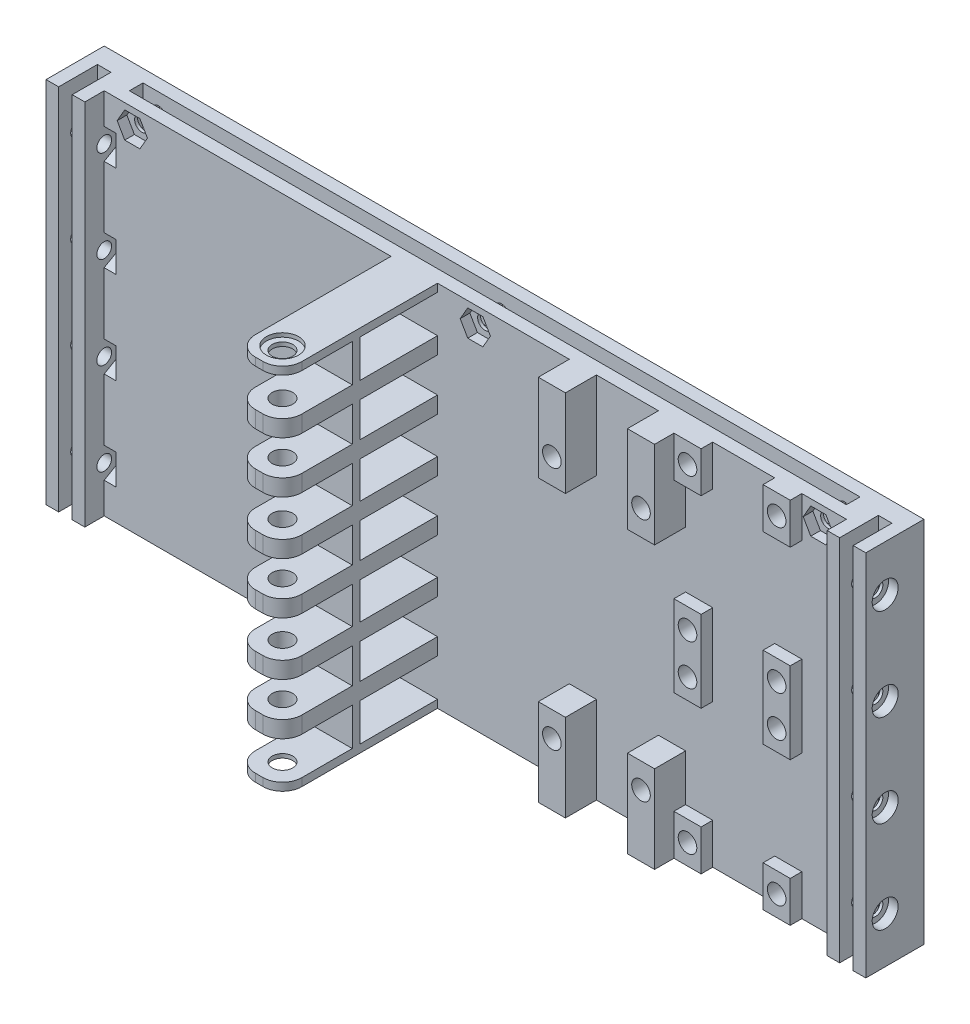
from build123d import *

# Parameters (mm, degrees)
SKETCH1_W               = 95
SKETCH1_H               = 12
BOSS_EXTRUDE1_DEPTH     = 10
SKETCH3_W               = 12
SKETCH3_H               = 2.025
SKETCH3_H_2             = 4.3
BOSS_EXTRUDE2_DEPTH     = 40
FILLET1_R               = 5
FILLET1_OF_MIRROR1_R    = 5
SKETCH5_R               = 2.65
CUT_EXTRUDE1_DEPTH      = 109.023145668
CUT_EXTRUDE2_DEPTH      = 1
SKETCH8_W               = 84
SKETCH8_H               = 95
SKETCH8_W_2             = 115.5
BOSS_EXTRUDE3_DEPTH     = 10
SKETCH9_W               = 10
SKETCH9_H               = 95
BOSS_EXTRUDE4_DEPTH     = 5
BOSS_EXTRUDE6_START     = 2.025
SKETCH13_W              = 12
SKETCH13_H              = 2
BOSS_EXTRUDE6_DEPTH     = 90.95
SKETCH14_W              = 185
SKETCH14_H              = 3.5
CUT_EXTRUDE4_DEPTH      = 10
SKETCH15_R              = 1.9
CUT_EXTRUDE5_DEPTH      = 199.641431949
SKETCH16_R              = 3.35
CUT_EXTRUDE6_DEPTH      = 2.5
CUT_EXTRUDE7_DEPTH      = 2.5
LPATTERN2_COUNT         = 3
LPATTERN2_PITCH         = 88.5
SKETCH18_W              = 7
SKETCH18_H              = 95
BOSS_EXTRUDE7_DEPTH     = 3
SKETCH19_W              = 7
SKETCH19_H              = 95
BOSS_EXTRUDE8_DEPTH     = 8
CUT_EXTRUDE8_REACH      = 159.687
SKETCH20_W              = 3.5
SKETCH20_H              = 10
LPATTERN3_COUNT         = 2
LPATTERN3_PITCH         = 201.5
SKETCH21_R              = 2.4
CUT_EXTRUDE9_DEPTH      = 3.8
SKETCH22_R              = 1.75
CUT_EXTRUDE10_DEPTH     = 0.6
SKETCH23_R              = 2.4
CUT_EXTRUDE11_DEPTH     = 3.8
SKETCH24_R              = 1.75
CUT_EXTRUDE12_DEPTH     = 0.6
LPATTERN4_COUNT         = 2
LPATTERN4_PITCH         = 23
LPATTERN4_COUNT_DIR2    = 2
LPATTERN4_PITCH_DIR2    = 37
LPATTERN5_COUNT         = 2
LPATTERN5_PITCH         = 23
MIRROR4_COPY_1_SKETCH_R = 2.4
MIRROR4_COPY_1_DEPTH    = 3.8
MIRROR4_COPY_2_SKETCH_R = 2.4
MIRROR4_COPY_2_DEPTH    = 3.8
MIRROR4_COPY_3_SKETCH_R = 2.4
MIRROR4_COPY_3_DEPTH    = 3.8
MIRROR4_COPY_4_SKETCH_R = 1.75
MIRROR4_COPY_4_DEPTH    = 0.6
MIRROR4_COPY_5_SKETCH_R = 1.75
MIRROR4_COPY_5_DEPTH    = 0.6
MIRROR4_COPY_6_SKETCH_R = 1.75
MIRROR4_COPY_6_DEPTH    = 0.6
MIRROR4_COPY_7_SKETCH_R = 2.4
MIRROR4_COPY_7_DEPTH    = 3.8
MIRROR4_COPY_8_SKETCH_R = 1.75
MIRROR4_COPY_8_DEPTH    = 0.6
SKETCH25_R              = 1.9
CUT_EXTRUDE13_DEPTH     = 10
SKETCH26_R              = 3.35
CUT_EXTRUDE14_DEPTH     = 2.5
CUT_EXTRUDE15_DEPTH     = 3
LPATTERN6_COUNT         = 4
LPATTERN6_PITCH         = 23.75
MIRROR5_COPY_1_SKETCH_R = 1.9
MIRROR5_COPY_1_DEPTH    = 10
MIRROR5_COPY_2_SKETCH_R = 1.9
MIRROR5_COPY_2_DEPTH    = 10
MIRROR5_COPY_3_SKETCH_R = 1.9
MIRROR5_COPY_3_DEPTH    = 10
MIRROR5_COPY_4_SKETCH_R = 3.35
MIRROR5_COPY_4_DEPTH    = 2.5
MIRROR5_COPY_5_SKETCH_R = 3.35
MIRROR5_COPY_5_DEPTH    = 2.5
MIRROR5_COPY_6_SKETCH_R = 3.35
MIRROR5_COPY_6_DEPTH    = 2.5
MIRROR5_COPY_7_DEPTH    = 3
MIRROR5_COPY_8_DEPTH    = 3
MIRROR5_COPY_9_DEPTH    = 3
SKETCH28_W              = 50
SKETCH28_H              = 8
CUT_EXTRUDE16_DEPTH     = 30
SKETCH29_W              = 12
SKETCH29_H              = 3
SKETCH29_W_2            = 14.5
CUT_EXTRUDE17_DEPTH     = 30


with BuildPart() as part:
    # Sketch1 → Boss-Extrude1 (new body)
    with BuildSketch(Plane(origin=(0, 0, 0), x_dir=(0, 1, 0), z_dir=(0, 0, 1))):
        with Locations((-47.5, 6)):
            Rectangle(SKETCH1_W, SKETCH1_H)
    extrude(amount=BOSS_EXTRUDE1_DEPTH)

    # Sketch3 → Boss-Extrude2 (add)
    with BuildSketch(Plane.XY.offset(10)):
        with Locations((-6, -1.0125)):
            Rectangle(SKETCH3_W, SKETCH3_H)
        with Locations((-6, -13.875)):
            Rectangle(SKETCH3_W, SKETCH3_H_2)
        with Locations((-6, -27.125)):
            Rectangle(SKETCH3_W, SKETCH3_H_2)
        with Locations((-6, -40.875)):
            Rectangle(SKETCH3_W, SKETCH3_H_2)
    boss_extrude2 = extrude(amount=BOSS_EXTRUDE2_DEPTH)

    # Fillet1
    fillet1_edges = [part.edges().sort_by_distance(p)[0] for p in [
        (-12, -1.0125, 50),
        (0, -1.0125, 50),
        (0, -13.875, 50),
        (-12, -13.875, 50),
        (0, -27.125, 50),
        (-12, -27.125, 50),
        (0, -40.875, 50),
        (-12, -40.875, 50),
    ]]
    fillet(fillet1_edges, radius=FILLET1_R)

    # Mirror1: Boss-Extrude2 across plane
    add(boss_extrude2.mirror(Plane.ZX.offset(-47.5)))

    # Fillet1 of Mirror1
    fillet1_of_mirror1_edges = [part.edges().sort_by_distance(p)[0] for p in [
        (-12, -93.9875, 50),
        (0, -93.9875, 50),
        (0, -81.125, 50),
        (-12, -81.125, 50),
        (0, -67.875, 50),
        (-12, -67.875, 50),
        (0, -54.125, 50),
        (-12, -54.125, 50),
    ]]
    fillet(fillet1_of_mirror1_edges, radius=FILLET1_OF_MIRROR1_R)

    # Sketch5 → Cut-Extrude1 (cut, through all)
    with BuildSketch(Plane(origin=(0, 0, 0), x_dir=(-1, 0, 0), z_dir=(0, 1, 0))):
        with Locations(Location((6, 44, 0), (0, 0, 90))):
            Circle(SKETCH5_R)
    extrude(amount=-CUT_EXTRUDE1_DEPTH, mode=Mode.SUBTRACT)

    # Sketch7 → Cut-Extrude2 (cut)
    with BuildSketch(Plane(origin=(0, 0, 0), x_dir=(-1, 0, 0), z_dir=(0, 1, 0))):
        with BuildLine():
            ThreePointArc((10.15, 44), (8.934493142, 46.934493142), (6, 48.15))
            Line((6, 48.15), (6, 46.65))
            ThreePointArc((6, 46.65), (7.87383297, 45.87383297), (8.65, 44))
            ThreePointArc((8.65, 44), (6, 41.35), (3.35, 44))
            Line((3.35, 44), (1.85, 44))
            ThreePointArc((1.85, 44), (6, 39.85), (10.15, 44))
        make_face()
        with BuildLine():
            Line((6, 46.65), (6, 48.15))
            ThreePointArc((6, 48.15), (3.065506858, 46.934493142), (1.85, 44))
            Line((1.85, 44), (3.35, 44))
            ThreePointArc((3.35, 44), (4.12616703, 45.87383297), (6, 46.65))
        make_face()
    cut_extrude2 = extrude(amount=-CUT_EXTRUDE2_DEPTH, mode=Mode.SUBTRACT)

    # Mirror2: Cut-Extrude2 across plane
    add(cut_extrude2.mirror(Plane.ZX.offset(-47.5)), mode=Mode.SUBTRACT)

    # Sketch8 → Boss-Extrude3 (add)
    with BuildSketch(Plane(origin=(0, 0, 0), x_dir=(1, 0, 0), z_dir=(0, 0, -1))):
        with Locations((-54, 47.5)):
            Rectangle(SKETCH8_W, SKETCH8_H)
        with Locations((57.75, 47.5)):
            Rectangle(SKETCH8_W_2, SKETCH8_H)
    extrude(amount=-BOSS_EXTRUDE3_DEPTH)

    # Sketch9 → Boss-Extrude4 (add)
    with BuildSketch(Plane.XY.offset(10)):
        with Locations((110.5, -47.5)):
            Rectangle(SKETCH9_W, SKETCH9_H)
        with Locations((-91, -47.5)):
            Rectangle(SKETCH9_W, SKETCH9_H)
    extrude(amount=BOSS_EXTRUDE4_DEPTH)

    # Sketch13 → Boss-Extrude6 (add)
    with BuildSketch(Plane(origin=(0, -95, 0), x_dir=(-1, 0, 0), z_dir=(0, 1, 0)).offset(BOSS_EXTRUDE6_START)):
        with Locations((6, 31)):
            Rectangle(SKETCH13_W, SKETCH13_H)
    extrude(amount=BOSS_EXTRUDE6_DEPTH)

    # Sketch14 → Cut-Extrude4 (cut)
    with BuildSketch(Plane(origin=(0, 0, 0), x_dir=(-1, 0, 0), z_dir=(0, 1, 0))):
        with Locations((-9.75, 5)):
            Rectangle(SKETCH14_W, SKETCH14_H)
    cut_extrude4 = extrude(amount=-CUT_EXTRUDE4_DEPTH, mode=Mode.SUBTRACT)

    # Mirror3: Cut-Extrude4 across plane
    add(cut_extrude4.mirror(Plane.ZX.offset(-47.5)), mode=Mode.SUBTRACT)

    # Sketch15 → Cut-Extrude5 (cut, through all)
    with BuildSketch(Plane(origin=(19.6145137, 61.498251456, 10), x_dir=(1, 0, 0), z_dir=(0, 0, 1))):
        with Locations((-98.3645137, -66.498251456)):
            Circle(SKETCH15_R)
    cut_extrude5 = extrude(amount=-CUT_EXTRUDE5_DEPTH, mode=Mode.SUBTRACT)

    # Sketch16 → Cut-Extrude6 (cut)
    with BuildSketch(Plane(origin=(-19.6145137, 61.498251456, 0), x_dir=(-1, 0, 0), z_dir=(0, 0, -1))):
        with Locations((59.1354863, -66.498251456)):
            Circle(SKETCH16_R)
    cut_extrude6 = extrude(amount=-CUT_EXTRUDE6_DEPTH, mode=Mode.SUBTRACT)

    # Sketch17 → Cut-Extrude7 (cut)
    with BuildSketch(Plane(origin=(19.6145137, 61.498251456, 10), x_dir=(1, 0, 0), z_dir=(0, 0, 1))):
        Polygon((-94.460368511, -66.498251456), (-96.412441106, -63.117162542), (-100.316586294, -63.117162542), (-102.268658888, -66.498251456), (-100.316586294, -69.879340369), (-96.412441106, -69.879340369), align=None)
    cut_extrude7 = extrude(amount=-CUT_EXTRUDE7_DEPTH, mode=Mode.SUBTRACT)

    # LPattern2: Cut-Extrude5, Cut-Extrude6, Cut-Extrude7 ×3
    with Locations(*[(i * LPATTERN2_PITCH, 0, 0) for i in range(1, LPATTERN2_COUNT)]):
        add(cut_extrude5, mode=Mode.SUBTRACT)
        add(cut_extrude6, mode=Mode.SUBTRACT)
        add(cut_extrude7, mode=Mode.SUBTRACT)

    # Sketch18 → Boss-Extrude7 (add)
    with BuildSketch(Plane.XY.offset(10)):
        with Locations((90.5, -47.5)):
            Rectangle(SKETCH18_W, SKETCH18_H)
        with Locations((67.5, -47.5)):
            Rectangle(SKETCH18_W, SKETCH18_H)
    extrude(amount=BOSS_EXTRUDE7_DEPTH)

    # Sketch19 → Boss-Extrude8 (add)
    with BuildSketch(Plane.XY.offset(10)):
        with Locations((37.5, -47.5)):
            Rectangle(SKETCH19_W, SKETCH19_H)
        with Locations((60.5, -47.5)):
            Rectangle(SKETCH19_W, SKETCH19_H)
    extrude(amount=BOSS_EXTRUDE8_DEPTH)

    # Sketch20 → Cut-Extrude8 (cut, up to next)
    with BuildSketch(Plane(origin=(0, 0, 0), x_dir=(-1, 0, 0), z_dir=(0, 1, 0)), mode=Mode.PRIVATE) as cut_extrude8_sk1:
        with Locations((-110.5, 10)):
            Rectangle(SKETCH20_W, SKETCH20_H)
    cut_extrude8_tool1 = extrude(cut_extrude8_sk1.sketch, amount=-CUT_EXTRUDE8_REACH, mode=Mode.PRIVATE) & part.part
    cut_extrude8 = cut_extrude8_tool1.solids().sort_by_distance((110.5, 0, 10))[0]
    add(cut_extrude8, mode=Mode.SUBTRACT)

    # LPattern3: Cut-Extrude8 ×2
    with Locations(*[(-i * LPATTERN3_PITCH, 0, 0) for i in range(1, LPATTERN3_COUNT)]):
        add(cut_extrude8, mode=Mode.SUBTRACT)

    # Sketch21 → Cut-Extrude9 (cut)
    with BuildSketch(Plane.XY.offset(13)):
        with Locations((90.5, -5.25)):
            Circle(SKETCH21_R)
    cut_extrude9 = extrude(amount=-CUT_EXTRUDE9_DEPTH, mode=Mode.SUBTRACT)

    # Sketch22 → Cut-Extrude10 (cut)
    with BuildSketch(Plane.XY.offset(9.2)):
        with Locations((90.5, -5.25)):
            Circle(SKETCH22_R)
    cut_extrude10 = extrude(amount=-CUT_EXTRUDE10_DEPTH, mode=Mode.SUBTRACT)

    # Sketch23 → Cut-Extrude11 (cut)
    with BuildSketch(Plane.XY.offset(18)):
        with Locations((60.5, -16)):
            Circle(SKETCH23_R)
    cut_extrude11 = extrude(amount=-CUT_EXTRUDE11_DEPTH, mode=Mode.SUBTRACT)

    # Sketch24 → Cut-Extrude12 (cut)
    with BuildSketch(Plane.XY.offset(14.2)):
        with Locations((60.5, -16)):
            Circle(SKETCH24_R)
    cut_extrude12 = extrude(amount=-CUT_EXTRUDE12_DEPTH, mode=Mode.SUBTRACT)

    # LPattern4: Cut-Extrude9, Cut-Extrude10 2 × 2
    with Locations(*[(-i * LPATTERN4_PITCH, -j * LPATTERN4_PITCH_DIR2, 0) for i in range(LPATTERN4_COUNT) for j in range(LPATTERN4_COUNT_DIR2) if (i, j) != (0, 0)]):
        add(cut_extrude9, mode=Mode.SUBTRACT)
        add(cut_extrude10, mode=Mode.SUBTRACT)

    # LPattern5: Cut-Extrude11, Cut-Extrude12 ×2
    with Locations(*[(-i * LPATTERN5_PITCH, 0, 0) for i in range(1, LPATTERN5_COUNT)]):
        add(cut_extrude11, mode=Mode.SUBTRACT)
        add(cut_extrude12, mode=Mode.SUBTRACT)

    # Mirror4: Cut-Extrude9, Cut-Extrude10, Cut-Extrude11, Cut-Extrude12 across plane
    add(cut_extrude9.mirror(Plane.ZX.offset(-47.5)), mode=Mode.SUBTRACT)
    add(cut_extrude10.mirror(Plane.ZX.offset(-47.5)), mode=Mode.SUBTRACT)
    add(cut_extrude11.mirror(Plane.ZX.offset(-47.5)), mode=Mode.SUBTRACT)
    add(cut_extrude12.mirror(Plane.ZX.offset(-47.5)), mode=Mode.SUBTRACT)

    # Mirror4 copy 1 sketch → Mirror4 copy 1 (cut)
    with BuildSketch(Plane(origin=(0, -58, 13), x_dir=(1, 0, 0), z_dir=(0, 0, 1))):
        with Locations((90.5, 5.25)):
            Circle(MIRROR4_COPY_1_SKETCH_R)
    extrude(amount=-MIRROR4_COPY_1_DEPTH, mode=Mode.SUBTRACT)

    # Mirror4 copy 2 sketch → Mirror4 copy 2 (cut)
    with BuildSketch(Plane(origin=(-23, -95, 13), x_dir=(1, 0, 0), z_dir=(0, 0, 1))):
        with Locations((90.5, 5.25)):
            Circle(MIRROR4_COPY_2_SKETCH_R)
    extrude(amount=-MIRROR4_COPY_2_DEPTH, mode=Mode.SUBTRACT)

    # Mirror4 copy 3 sketch → Mirror4 copy 3 (cut)
    with BuildSketch(Plane(origin=(-23, -58, 13), x_dir=(1, 0, 0), z_dir=(0, 0, 1))):
        with Locations((90.5, 5.25)):
            Circle(MIRROR4_COPY_3_SKETCH_R)
    extrude(amount=-MIRROR4_COPY_3_DEPTH, mode=Mode.SUBTRACT)

    # Mirror4 copy 4 sketch → Mirror4 copy 4 (cut)
    with BuildSketch(Plane(origin=(0, -58, 9.2), x_dir=(1, 0, 0), z_dir=(0, 0, 1))):
        with Locations((90.5, 5.25)):
            Circle(MIRROR4_COPY_4_SKETCH_R)
    extrude(amount=-MIRROR4_COPY_4_DEPTH, mode=Mode.SUBTRACT)

    # Mirror4 copy 5 sketch → Mirror4 copy 5 (cut)
    with BuildSketch(Plane(origin=(-23, -95, 9.2), x_dir=(1, 0, 0), z_dir=(0, 0, 1))):
        with Locations((90.5, 5.25)):
            Circle(MIRROR4_COPY_5_SKETCH_R)
    extrude(amount=-MIRROR4_COPY_5_DEPTH, mode=Mode.SUBTRACT)

    # Mirror4 copy 6 sketch → Mirror4 copy 6 (cut)
    with BuildSketch(Plane(origin=(-23, -58, 9.2), x_dir=(1, 0, 0), z_dir=(0, 0, 1))):
        with Locations((90.5, 5.25)):
            Circle(MIRROR4_COPY_6_SKETCH_R)
    extrude(amount=-MIRROR4_COPY_6_DEPTH, mode=Mode.SUBTRACT)

    # Mirror4 copy 7 sketch → Mirror4 copy 7 (cut)
    with BuildSketch(Plane(origin=(-23, -95, 18), x_dir=(1, 0, 0), z_dir=(0, 0, 1))):
        with Locations((60.5, 16)):
            Circle(MIRROR4_COPY_7_SKETCH_R)
    extrude(amount=-MIRROR4_COPY_7_DEPTH, mode=Mode.SUBTRACT)

    # Mirror4 copy 8 sketch → Mirror4 copy 8 (cut)
    with BuildSketch(Plane(origin=(-23, -95, 14.2), x_dir=(1, 0, 0), z_dir=(0, 0, 1))):
        with Locations((60.5, 16)):
            Circle(MIRROR4_COPY_8_SKETCH_R)
    extrude(amount=-MIRROR4_COPY_8_DEPTH, mode=Mode.SUBTRACT)

    # Sketch25 → Cut-Extrude13 (cut)
    with BuildSketch(Plane.YZ.offset(115.5)):
        with Locations((-11.875, 10)):
            Circle(SKETCH25_R)
    cut_extrude13 = extrude(amount=-CUT_EXTRUDE13_DEPTH, mode=Mode.SUBTRACT)

    # Sketch26 → Cut-Extrude14 (cut)
    with BuildSketch(Plane.YZ.offset(115.5)):
        with Locations((-11.875, 10)):
            Circle(SKETCH26_R)
    cut_extrude14 = extrude(amount=-CUT_EXTRUDE14_DEPTH, mode=Mode.SUBTRACT)

    # Sketch27 → Cut-Extrude15 (cut)
    with BuildSketch(Plane(origin=(105.5, 0, 0), x_dir=(0, -1, 0), z_dir=(-1, 0, 0))):
        Polygon((9.922927406, 13.381088913), (7.970854812, 10), (9.922927406, 6.618911087), (13.827072594, 6.618911087), (15.779145188, 10), (13.827072594, 13.381088913), align=None)
    cut_extrude15 = extrude(amount=CUT_EXTRUDE15_DEPTH, mode=Mode.SUBTRACT)

    # LPattern6: Cut-Extrude13, Cut-Extrude14, Cut-Extrude15 ×4
    with Locations(*[(0, -i * LPATTERN6_PITCH, 0) for i in range(1, LPATTERN6_COUNT)]):
        add(cut_extrude13, mode=Mode.SUBTRACT)
        add(cut_extrude14, mode=Mode.SUBTRACT)
        add(cut_extrude15, mode=Mode.SUBTRACT)

    # Mirror5: Cut-Extrude13, Cut-Extrude14, Cut-Extrude15 across plane
    add(cut_extrude13.mirror(Plane(origin=(9.75, 0, 0), x_dir=(0, 0, 1), z_dir=(1, 0, 0))), mode=Mode.SUBTRACT)
    add(cut_extrude14.mirror(Plane(origin=(9.75, 0, 0), x_dir=(0, 0, 1), z_dir=(1, 0, 0))), mode=Mode.SUBTRACT)
    add(cut_extrude15.mirror(Plane(origin=(9.75, 0, 0), x_dir=(0, 0, 1), z_dir=(1, 0, 0))), mode=Mode.SUBTRACT)

    # Mirror5 copy 1 sketch → Mirror5 copy 1 (cut)
    with BuildSketch(Plane(origin=(-96, -23.75, 0), x_dir=(0, 1, 0), z_dir=(-1, 0, 0))):
        with Locations((-11.875, -10)):
            Circle(MIRROR5_COPY_1_SKETCH_R)
    extrude(amount=-MIRROR5_COPY_1_DEPTH, mode=Mode.SUBTRACT)

    # Mirror5 copy 2 sketch → Mirror5 copy 2 (cut)
    with BuildSketch(Plane(origin=(-96, -47.5, 0), x_dir=(0, 1, 0), z_dir=(-1, 0, 0))):
        with Locations((-11.875, -10)):
            Circle(MIRROR5_COPY_2_SKETCH_R)
    extrude(amount=-MIRROR5_COPY_2_DEPTH, mode=Mode.SUBTRACT)

    # Mirror5 copy 3 sketch → Mirror5 copy 3 (cut)
    with BuildSketch(Plane(origin=(-96, -71.25, 0), x_dir=(0, 1, 0), z_dir=(-1, 0, 0))):
        with Locations((-11.875, -10)):
            Circle(MIRROR5_COPY_3_SKETCH_R)
    extrude(amount=-MIRROR5_COPY_3_DEPTH, mode=Mode.SUBTRACT)

    # Mirror5 copy 4 sketch → Mirror5 copy 4 (cut)
    with BuildSketch(Plane(origin=(-96, -23.75, 0), x_dir=(0, 1, 0), z_dir=(-1, 0, 0))):
        with Locations((-11.875, -10)):
            Circle(MIRROR5_COPY_4_SKETCH_R)
    extrude(amount=-MIRROR5_COPY_4_DEPTH, mode=Mode.SUBTRACT)

    # Mirror5 copy 5 sketch → Mirror5 copy 5 (cut)
    with BuildSketch(Plane(origin=(-96, -47.5, 0), x_dir=(0, 1, 0), z_dir=(-1, 0, 0))):
        with Locations((-11.875, -10)):
            Circle(MIRROR5_COPY_5_SKETCH_R)
    extrude(amount=-MIRROR5_COPY_5_DEPTH, mode=Mode.SUBTRACT)

    # Mirror5 copy 6 sketch → Mirror5 copy 6 (cut)
    with BuildSketch(Plane(origin=(-96, -71.25, 0), x_dir=(0, 1, 0), z_dir=(-1, 0, 0))):
        with Locations((-11.875, -10)):
            Circle(MIRROR5_COPY_6_SKETCH_R)
    extrude(amount=-MIRROR5_COPY_6_DEPTH, mode=Mode.SUBTRACT)

    # Mirror5 copy 7 sketch → Mirror5 copy 7 (cut)
    with BuildSketch(Plane(origin=(-86, -23.75, 0), x_dir=(0, -1, 0), z_dir=(1, 0, 0))):
        Polygon((9.922927406, -13.381088913), (7.970854812, -10), (9.922927406, -6.618911087), (13.827072594, -6.618911087), (15.779145188, -10), (13.827072594, -13.381088913), align=None)
    extrude(amount=MIRROR5_COPY_7_DEPTH, mode=Mode.SUBTRACT)

    # Mirror5 copy 8 sketch → Mirror5 copy 8 (cut)
    with BuildSketch(Plane(origin=(-86, -47.5, 0), x_dir=(0, -1, 0), z_dir=(1, 0, 0))):
        Polygon((9.922927406, -13.381088913), (7.970854812, -10), (9.922927406, -6.618911087), (13.827072594, -6.618911087), (15.779145188, -10), (13.827072594, -13.381088913), align=None)
    extrude(amount=MIRROR5_COPY_8_DEPTH, mode=Mode.SUBTRACT)

    # Mirror5 copy 9 sketch → Mirror5 copy 9 (cut)
    with BuildSketch(Plane(origin=(-86, -71.25, 0), x_dir=(0, -1, 0), z_dir=(1, 0, 0))):
        Polygon((9.922927406, -13.381088913), (7.970854812, -10), (9.922927406, -6.618911087), (13.827072594, -6.618911087), (15.779145188, -10), (13.827072594, -13.381088913), align=None)
    extrude(amount=MIRROR5_COPY_9_DEPTH, mode=Mode.SUBTRACT)

    # Sketch28 → Cut-Extrude16 (cut)
    with BuildSketch(Plane(origin=(34, 0, 0), x_dir=(0, -1, 0), z_dir=(-1, 0, 0))):
        with Locations((47.5, 14)):
            Rectangle(SKETCH28_W, SKETCH28_H)
    extrude(amount=-CUT_EXTRUDE16_DEPTH, mode=Mode.SUBTRACT)

    # Sketch29 → Cut-Extrude17 (cut)
    with BuildSketch(Plane(origin=(64, 0, 0), x_dir=(0, -1, 0), z_dir=(-1, 0, 0))):
        with Locations((16.5, 11.5)):
            Rectangle(SKETCH29_W, SKETCH29_H)
        with Locations((29.75, 11.5)):
            Rectangle(SKETCH29_W_2, SKETCH29_H)
        with Locations((78.5, 11.5)):
            Rectangle(SKETCH29_W, SKETCH29_H)
        with Locations((65.25, 11.5)):
            Rectangle(SKETCH29_W_2, SKETCH29_H)
    extrude(amount=-CUT_EXTRUDE17_DEPTH, mode=Mode.SUBTRACT)


solid = part.part
